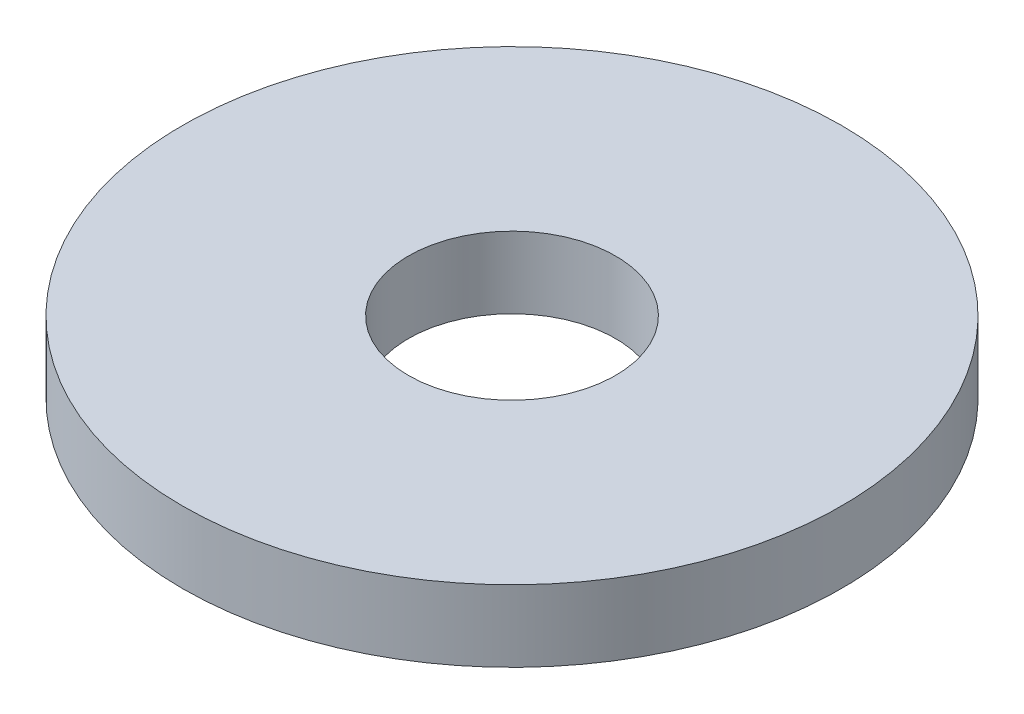
from build123d import *

# Parameters (mm, degrees)
SKETCH1_R           = 87.5
BOSS_EXTRUDE1_DEPTH = 19
SKETCH2_R           = 27.5
CUT_EXTRUDE1_DEPTH  = 126.193849689


with BuildPart() as part:
    # Sketch1 → Boss-Extrude1 (new body)
    with BuildSketch(Plane(origin=(0, 0, 0), x_dir=(1, 0, 0), z_dir=(0, 1, 0))):
        Circle(SKETCH1_R)
    extrude(amount=BOSS_EXTRUDE1_DEPTH)

    # Sketch2 → Cut-Extrude1 (cut, through all)
    with BuildSketch(Plane(origin=(0, 0, 0), x_dir=(1, 0, 0), z_dir=(0, 1, 0))):
        Circle(SKETCH2_R)
    extrude(amount=CUT_EXTRUDE1_DEPTH, mode=Mode.SUBTRACT)


solid = part.part
